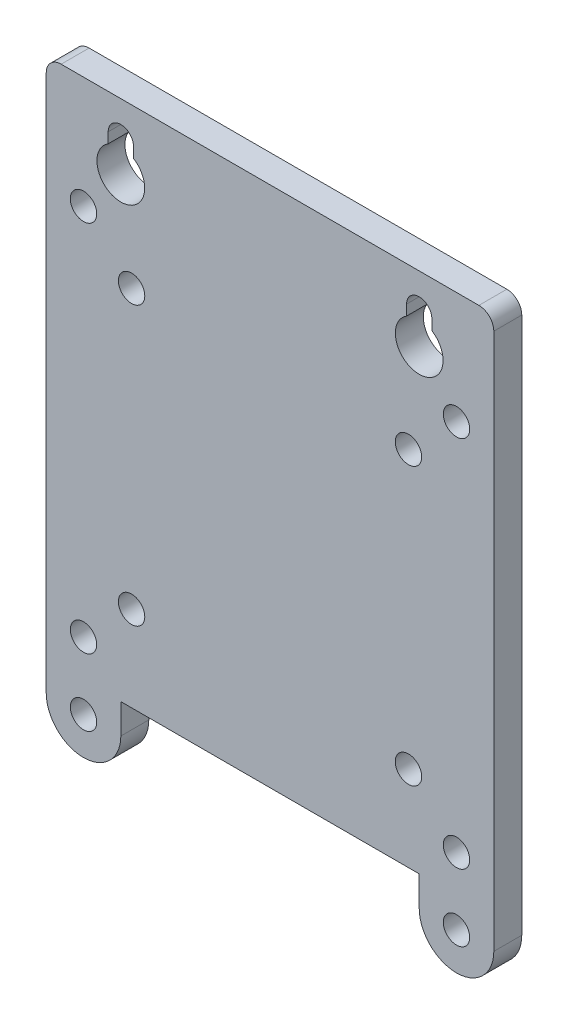
from build123d import *

# Parameters (mm, degrees)
SKETCH1_W                 = 76.2
SKETCH1_H                 = 88.9
BOSS_EXTRUDE1_DEPTH       = 4.7625
F_8_CLEARANCE_HOLE1_D     = 4.4958
FILLET1_R                 = 2.54
F_8_CLEARANCE_SLOT1_DEPTH = 4.7625
SKETCH6_R                 = 4.064
CUT_EXTRUDE1_DEPTH        = 64.678343306
F_8_CLEARANCE_HOLE2_D     = 4.4958
SKETCH9_R                 = 2.2479
BOSS_EXTRUDE2_DEPTH       = 4.7625


# Read off the part's stored shape, not the designer's step: #8 Clearance Slot1
with BuildPart() as part:
    # Sketch1 → Boss-Extrude1 (new body)
    with BuildSketch(Plane.XY):
        with Locations((0, 6.35)):
            Rectangle(SKETCH1_W, SKETCH1_H)
    extrude(amount=BOSS_EXTRUDE1_DEPTH)

    # #8 Clearance Hole1 (through all)
    with Locations(Plane.XY.offset(4.7625)):
        with Locations((23.57, 23.57), (-23.57, 23.755), (23.57, -23.57), (-23.57, -23.57)):
            Hole(F_8_CLEARANCE_HOLE1_D / 2)

    # Fillet1
    fillet1_edges = [part.edges().sort_by_distance(p)[0] for p in [
        (-38.1, 50.8, 2.38125),
        (38.1, 50.8, 2.38125),
        (38.1, -38.1, 2.38125),
        (-38.1, -38.1, 2.38125),
    ]]
    fillet(fillet1_edges, radius=FILLET1_R)

    # #8 Clearance Slot1 outline → #8 Clearance Slot1 (cut)
    with BuildSketch(Plane.XY):
        with BuildLine():
            ThreePointArc((-27.55265, 39.61765), (-25.4, 37.465), (-23.24735, 39.61765))
            Line((-23.24735, 39.61765), (-23.24735, 44.83735))
            ThreePointArc((-23.24735, 44.83735), (-25.4, 46.99), (-27.55265, 44.83735))
            Line((-27.55265, 44.83735), (-27.55265, 39.61765))
        make_face()
        with BuildLine():
            ThreePointArc((23.24735, 39.61765), (25.4, 37.465), (27.55265, 39.61765))
            Line((27.55265, 39.61765), (27.55265, 44.83735))
            ThreePointArc((27.55265, 44.83735), (25.4, 46.99), (23.24735, 44.83735))
            Line((23.24735, 44.83735), (23.24735, 39.61765))
        make_face()
    extrude(amount=F_8_CLEARANCE_SLOT1_DEPTH, mode=Mode.SUBTRACT)

    # Sketch6 → Cut-Extrude1 (cut, through all)
    with BuildSketch(Plane(origin=(0, 0, 0), x_dir=(-1, 0, 0), z_dir=(0, 0, -1))):
        with Locations((-25.4, 39.61765)):
            Circle(SKETCH6_R)
        with Locations((25.4, 39.61765)):
            Circle(SKETCH6_R)
    extrude(amount=-CUT_EXTRUDE1_DEPTH, mode=Mode.SUBTRACT)

    # #8 Clearance Hole2 (through all)
    with Locations(Plane(origin=(0, 0, 0), x_dir=(-1, 0, 0), z_dir=(0, 0, -1))):
        with Locations((31.75, 31.75), (31.75, -31.75), (-31.75, -31.75), (-31.75, 31.75)):
            Hole(F_8_CLEARANCE_HOLE2_D / 2)

    # Sketch9 → Boss-Extrude2 (add, through all)
    # profile 1 of 2: a face of its own
    with BuildSketch(Plane.XY.offset(4.7625)):
        with BuildLine():
            Line((-38.1, -43.18), (-38.1, -35.56))
            Line((-38.1, -35.56), (-25.4, -35.56))
            Line((-25.4, -35.56), (-25.4, -43.18))
            ThreePointArc((-25.4, -43.18), (-31.75, -49.53), (-38.1, -43.18))
        make_face()
        with Locations((-31.75, -43.18)):
            Circle(SKETCH9_R, mode=Mode.SUBTRACT)
    # profile 2 of 2: a face of its own
    with BuildSketch(Plane.XY.offset(4.7625)):
        with BuildLine():
            Line((25.4, -35.56), (25.4, -43.18))
            ThreePointArc((25.4, -43.18), (31.75, -49.53), (38.1, -43.18))
            Line((38.1, -43.18), (38.1, -35.56))
            Line((38.1, -35.56), (25.4, -35.56))
        make_face()
        with Locations((31.75, -43.18)):
            Circle(SKETCH9_R, mode=Mode.SUBTRACT)
    extrude(amount=-BOSS_EXTRUDE2_DEPTH)


solid = part.part
